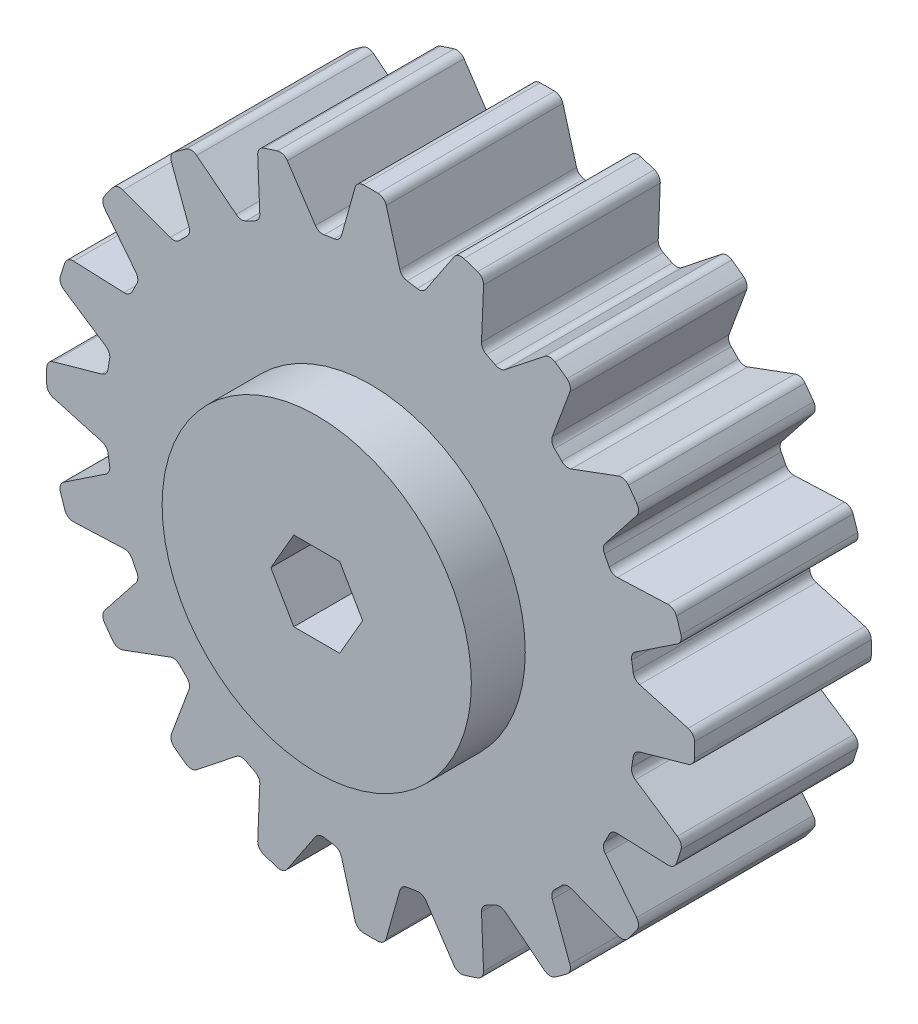
from build123d import *

# Parameters (mm, degrees)
SKETCH1_R                = 9
BODY_DEPTH               = 6
TOOTH_DEPTH              = 6
TOOTH_FILLET_R           = 0.3
TOOTH_START              = -6
TOOTH_PATTERN_DEPTH      = 6
SKETCH4_R                = 8
SKETCH4_R_2              = 5.25
RESSES2_DEPTH            = 1
BOSS_EXTRUDE1_DEPTH      = 1.83
BOSS_EXTRUDE1_DEPTH_BACK = 7.83
SKETCH9_R                = 5.25
CUT_EXTRUDE1_DEPTH       = 19.311624723
BOSS_EXTRUDE2_START      = 1
SKETCH11_R               = 8
SKETCH11_R_2             = 5.25
BOSS_EXTRUDE2_DEPTH      = 1


# Read off the part's stored shape, not the designer's step: Tooth Pattern
with BuildPart() as part:
    # Sketch1 → Body (new body)
    with BuildSketch(Plane.XY):
        Circle(SKETCH1_R)
    extrude(amount=-BODY_DEPTH)

    # Sketch2 → Tooth (add)
    with BuildSketch(Plane.XY):
        with BuildLine():
            Line((-0.755, 9.971458018), (-1.044579423, 8.939175232))
            ThreePointArc((-1.044579423, 8.939175232), (0, 9), (1.044579423, 8.939175232))
            Line((1.044579423, 8.939175232), (0.755, 9.971458018))
            Line((0.755, 9.971458018), (0.469279316, 10.989985301))
            ThreePointArc((0.469279316, 10.989985301), (0, 11), (-0.469279316, 10.989985301))
            Line((-0.469279316, 10.989985301), (-0.755, 9.971458018))
        make_face()
    extrude(amount=-TOOTH_DEPTH)

    # Tooth Fillet
    tooth_fillet_edges = [part.edges().sort_by_distance(p)[0] for p in [
        (1.044579423, 8.939175232, -3),
        (-1.044579423, 8.939175232, -3),
        (-0.469279316, 10.989985301, -3),
        (0.469279316, 10.989985301, -3),
    ]]
    fillet(tooth_fillet_edges, radius=TOOTH_FILLET_R)

    # Tooth Pattern outline → Tooth Pattern (add)
    with BuildSketch(Plane.XY.offset(TOOTH_START)):
        with BuildLine():
            ThreePointArc((-2.827914453, 10.414174029), (-2.975931492, 10.530102894), (-3.163875175, 10.535174127))
            ThreePointArc((-3.163875175, 10.535174127), (-3.399186938, 10.461621679), (-3.632791197, 10.382814075))
            ThreePointArc((-3.632791197, 10.382814075), (-3.781860036, 10.268240837), (-3.833467058, 10.087450182))
            Line((-3.833467058, 10.087450182), (-3.763889398, 8.37741104))
            ThreePointArc((-3.763889398, 8.37741104), (-3.806168906, 8.211241026), (-3.932556176, 8.095369165))
            ThreePointArc((-3.932556176, 8.095369165), (-2.781152949, 8.559508647), (-1.576833829, 8.860789754))
            ThreePointArc((-1.576833829, 8.860789754), (-1.74719105, 8.880243486), (-1.879068174, 8.98982658))
            Line((-1.879068174, 8.98982658), (-2.827914453, 10.414174029))
        make_face()
        with BuildLine():
            ThreePointArc((1.576833829, 8.860789754), (2.781152949, 8.559508647), (3.932556176, 8.095369165))
            ThreePointArc((3.932556176, 8.095369165), (3.806168906, 8.211241026), (3.763889398, 8.37741104))
            Line((3.763889398, 8.37741104), (3.833467058, 10.087450182))
            ThreePointArc((3.833467058, 10.087450182), (3.781860036, 10.268240837), (3.632791197, 10.382814075))
            ThreePointArc((3.632791197, 10.382814075), (3.399186938, 10.461621679), (3.163875175, 10.535174127))
            ThreePointArc((3.163875175, 10.535174127), (2.975931492, 10.530102894), (2.827914453, 10.414174029))
            Line((2.827914453, 10.414174029), (1.879068174, 8.98982658))
            ThreePointArc((1.879068174, 8.98982658), (1.74719105, 8.880243486), (1.576833829, 8.860789754))
        make_face()
        with BuildLine():
            ThreePointArc((4.237792706, 7.939843385), (5.290067271, 7.281152949), (6.241689825, 6.483926906))
            ThreePointArc((6.241689825, 6.483926906), (6.157294763, 6.633183409), (6.168433919, 6.80428557))
            Line((6.168433919, 6.80428557), (6.763037361, 8.40912876))
            ThreePointArc((6.763037361, 8.40912876), (6.769823551, 8.597018337), (6.663455739, 8.752048767))
            ThreePointArc((6.663455739, 8.752048767), (6.465637775, 8.899186938), (6.264571946, 9.041854806))
            ThreePointArc((6.264571946, 9.041854806), (6.084259784, 9.09510957), (5.907663226, 9.030594447))
            Line((5.907663226, 9.030594447), (4.565109221, 7.96916915))
            ThreePointArc((4.565109221, 7.96916915), (4.405823585, 7.905701707), (4.237792706, 7.939843385))
        make_face()
        with BuildLine():
            ThreePointArc((6.483926906, 6.241689825), (7.281152949, 5.290067271), (7.939843385, 4.237792706))
            ThreePointArc((7.939843385, 4.237792706), (7.905701707, 4.405823585), (7.96916915, 4.565109221))
            Line((7.96916915, 4.565109221), (9.030594447, 5.907663226))
            ThreePointArc((9.030594447, 5.907663226), (9.09510957, 6.084259784), (9.041854806, 6.264571946))
            ThreePointArc((9.041854806, 6.264571946), (8.899186938, 6.465637775), (8.752048767, 6.663455739))
            ThreePointArc((8.752048767, 6.663455739), (8.597018337, 6.769823551), (8.40912876, 6.763037361))
            Line((8.40912876, 6.763037361), (6.80428557, 6.168433919))
            ThreePointArc((6.80428557, 6.168433919), (6.633183409, 6.157294763), (6.483926906, 6.241689825))
        make_face()
        with BuildLine():
            ThreePointArc((8.095369165, 3.932556176), (8.559508647, 2.781152949), (8.860789755, 1.576833829))
            ThreePointArc((8.860789755, 1.576833829), (8.880243486, 1.74719105), (8.98982658, 1.879068174))
            Line((8.98982658, 1.879068174), (10.414174029, 2.827914453))
            ThreePointArc((10.414174029, 2.827914453), (10.530102894, 2.975931492), (10.535174127, 3.163875175))
            ThreePointArc((10.535174127, 3.163875175), (10.461621679, 3.399186938), (10.382814075, 3.632791197))
            ThreePointArc((10.382814075, 3.632791197), (10.268240837, 3.781860036), (10.087450182, 3.833467058))
            Line((10.087450182, 3.833467058), (8.37741104, 3.763889398))
            ThreePointArc((8.37741104, 3.763889398), (8.211241026, 3.806168906), (8.095369165, 3.932556176))
        make_face()
        with BuildLine():
            ThreePointArc((8.914380286, 1.238476529), (9, 0), (8.914380286, -1.238476529))
            ThreePointArc((8.914380286, -1.238476529), (8.985525161, -1.082468718), (9.130497149, -0.990909159))
            Line((9.130497149, -0.990909159), (10.778341697, -0.528650289))
            ThreePointArc((10.778341697, -0.528650289), (10.93433638, -0.42370171), (10.997237201, -0.246523742))
            ThreePointArc((10.997237201, -0.246523742), (11, 0), (10.997237201, 0.246523742))
            ThreePointArc((10.997237201, 0.246523742), (10.93433638, 0.42370171), (10.778341697, 0.528650289))
            Line((10.778341697, 0.528650289), (9.130497149, 0.990909159))
            ThreePointArc((9.130497149, 0.990909159), (8.985525161, 1.082468718), (8.914380286, 1.238476529))
        make_face()
        with BuildLine():
            ThreePointArc((8.860789755, -1.576833829), (8.559508647, -2.781152949), (8.095369165, -3.932556176))
            ThreePointArc((8.095369165, -3.932556176), (8.211241026, -3.806168906), (8.37741104, -3.763889398))
            Line((8.37741104, -3.763889398), (10.087450182, -3.833467058))
            ThreePointArc((10.087450182, -3.833467058), (10.268240837, -3.781860036), (10.382814075, -3.632791197))
            ThreePointArc((10.382814075, -3.632791197), (10.461621679, -3.399186938), (10.535174127, -3.163875175))
            ThreePointArc((10.535174127, -3.163875175), (10.530102894, -2.975931492), (10.414174029, -2.827914453))
            Line((10.414174029, -2.827914453), (8.98982658, -1.879068174))
            ThreePointArc((8.98982658, -1.879068174), (8.880243486, -1.74719105), (8.860789755, -1.576833829))
        make_face()
        with BuildLine():
            ThreePointArc((7.939843385, -4.237792706), (7.281152949, -5.290067271), (6.483926906, -6.241689825))
            ThreePointArc((6.483926906, -6.241689825), (6.633183409, -6.157294763), (6.80428557, -6.168433919))
            Line((6.80428557, -6.168433919), (8.40912876, -6.763037361))
            ThreePointArc((8.40912876, -6.763037361), (8.597018337, -6.769823551), (8.752048767, -6.663455739))
            ThreePointArc((8.752048767, -6.663455739), (8.899186938, -6.465637775), (9.041854806, -6.264571946))
            ThreePointArc((9.041854806, -6.264571946), (9.09510957, -6.084259784), (9.030594447, -5.907663226))
            Line((9.030594447, -5.907663226), (7.96916915, -4.565109221))
            ThreePointArc((7.96916915, -4.565109221), (7.905701707, -4.405823585), (7.939843385, -4.237792706))
        make_face()
        with BuildLine():
            ThreePointArc((6.241689825, -6.483926906), (5.290067271, -7.281152949), (4.237792706, -7.939843385))
            ThreePointArc((4.237792706, -7.939843385), (4.405823585, -7.905701707), (4.565109221, -7.96916915))
            Line((4.565109221, -7.96916915), (5.907663226, -9.030594447))
            ThreePointArc((5.907663226, -9.030594447), (6.084259784, -9.09510957), (6.264571946, -9.041854806))
            ThreePointArc((6.264571946, -9.041854806), (6.465637775, -8.899186938), (6.663455739, -8.752048767))
            ThreePointArc((6.663455739, -8.752048767), (6.769823551, -8.597018337), (6.763037361, -8.40912876))
            Line((6.763037361, -8.40912876), (6.168433919, -6.80428557))
            ThreePointArc((6.168433919, -6.80428557), (6.157294763, -6.633183409), (6.241689825, -6.483926906))
        make_face()
        with BuildLine():
            ThreePointArc((3.932556176, -8.095369165), (2.781152949, -8.559508647), (1.576833829, -8.860789755))
            ThreePointArc((1.576833829, -8.860789755), (1.74719105, -8.880243486), (1.879068174, -8.98982658))
            Line((1.879068174, -8.98982658), (2.827914453, -10.414174029))
            ThreePointArc((2.827914453, -10.414174029), (2.975931492, -10.530102894), (3.163875175, -10.535174127))
            ThreePointArc((3.163875175, -10.535174127), (3.399186938, -10.461621679), (3.632791197, -10.382814075))
            ThreePointArc((3.632791197, -10.382814075), (3.781860036, -10.268240837), (3.833467058, -10.087450182))
            Line((3.833467058, -10.087450182), (3.763889398, -8.37741104))
            ThreePointArc((3.763889398, -8.37741104), (3.806168906, -8.211241026), (3.932556176, -8.095369165))
        make_face()
        with BuildLine():
            ThreePointArc((1.238476529, -8.914380286), (0, -9), (-1.238476529, -8.914380286))
            ThreePointArc((-1.238476529, -8.914380286), (-1.082468718, -8.985525161), (-0.990909159, -9.130497149))
            Line((-0.990909159, -9.130497149), (-0.528650289, -10.778341697))
            ThreePointArc((-0.528650289, -10.778341697), (-0.42370171, -10.93433638), (-0.246523742, -10.997237201))
            ThreePointArc((-0.246523742, -10.997237201), (0, -11), (0.246523742, -10.997237201))
            ThreePointArc((0.246523742, -10.997237201), (0.42370171, -10.93433638), (0.528650289, -10.778341697))
            Line((0.528650289, -10.778341697), (0.990909159, -9.130497149))
            ThreePointArc((0.990909159, -9.130497149), (1.082468718, -8.985525161), (1.238476529, -8.914380286))
        make_face()
        with BuildLine():
            ThreePointArc((-1.576833829, -8.860789755), (-2.781152949, -8.559508647), (-3.932556176, -8.095369165))
            ThreePointArc((-3.932556176, -8.095369165), (-3.806168906, -8.211241026), (-3.763889398, -8.37741104))
            Line((-3.763889398, -8.37741104), (-3.833467058, -10.087450182))
            ThreePointArc((-3.833467058, -10.087450182), (-3.781860036, -10.268240837), (-3.632791197, -10.382814075))
            ThreePointArc((-3.632791197, -10.382814075), (-3.399186938, -10.461621679), (-3.163875175, -10.535174127))
            ThreePointArc((-3.163875175, -10.535174127), (-2.975931492, -10.530102894), (-2.827914453, -10.414174029))
            Line((-2.827914453, -10.414174029), (-1.879068174, -8.98982658))
            ThreePointArc((-1.879068174, -8.98982658), (-1.74719105, -8.880243486), (-1.576833829, -8.860789755))
        make_face()
        with BuildLine():
            ThreePointArc((-4.237792706, -7.939843385), (-5.290067271, -7.281152949), (-6.241689825, -6.483926906))
            ThreePointArc((-6.241689825, -6.483926906), (-6.157294763, -6.633183409), (-6.168433919, -6.80428557))
            Line((-6.168433919, -6.80428557), (-6.763037361, -8.40912876))
            ThreePointArc((-6.763037361, -8.40912876), (-6.769823551, -8.597018337), (-6.663455739, -8.752048767))
            ThreePointArc((-6.663455739, -8.752048767), (-6.465637775, -8.899186938), (-6.264571946, -9.041854806))
            ThreePointArc((-6.264571946, -9.041854806), (-6.084259784, -9.09510957), (-5.907663226, -9.030594447))
            Line((-5.907663226, -9.030594447), (-4.565109221, -7.96916915))
            ThreePointArc((-4.565109221, -7.96916915), (-4.405823585, -7.905701707), (-4.237792706, -7.939843385))
        make_face()
        with BuildLine():
            ThreePointArc((-6.483926906, -6.241689825), (-7.281152949, -5.290067271), (-7.939843385, -4.237792706))
            ThreePointArc((-7.939843385, -4.237792706), (-7.905701707, -4.405823585), (-7.96916915, -4.565109221))
            Line((-7.96916915, -4.565109221), (-9.030594447, -5.907663226))
            ThreePointArc((-9.030594447, -5.907663226), (-9.09510957, -6.084259784), (-9.041854806, -6.264571946))
            ThreePointArc((-9.041854806, -6.264571946), (-8.899186938, -6.465637775), (-8.752048767, -6.663455739))
            ThreePointArc((-8.752048767, -6.663455739), (-8.597018337, -6.769823551), (-8.40912876, -6.763037361))
            Line((-8.40912876, -6.763037361), (-6.80428557, -6.168433919))
            ThreePointArc((-6.80428557, -6.168433919), (-6.633183409, -6.157294763), (-6.483926906, -6.241689825))
        make_face()
        with BuildLine():
            ThreePointArc((-8.095369165, -3.932556176), (-8.559508647, -2.781152949), (-8.860789755, -1.576833829))
            ThreePointArc((-8.860789755, -1.576833829), (-8.880243486, -1.74719105), (-8.98982658, -1.879068174))
            Line((-8.98982658, -1.879068174), (-10.414174029, -2.827914453))
            ThreePointArc((-10.414174029, -2.827914453), (-10.530102894, -2.975931492), (-10.535174127, -3.163875175))
            ThreePointArc((-10.535174127, -3.163875175), (-10.461621679, -3.399186938), (-10.382814075, -3.632791197))
            ThreePointArc((-10.382814075, -3.632791197), (-10.268240837, -3.781860036), (-10.087450182, -3.833467058))
            Line((-10.087450182, -3.833467058), (-8.37741104, -3.763889398))
            ThreePointArc((-8.37741104, -3.763889398), (-8.211241026, -3.806168906), (-8.095369165, -3.932556176))
        make_face()
        with BuildLine():
            ThreePointArc((-8.914380286, -1.238476529), (-9, 0), (-8.914380286, 1.238476529))
            ThreePointArc((-8.914380286, 1.238476529), (-8.985525161, 1.082468718), (-9.130497149, 0.990909159))
            Line((-9.130497149, 0.990909159), (-10.778341697, 0.528650289))
            ThreePointArc((-10.778341697, 0.528650289), (-10.93433638, 0.42370171), (-10.997237201, 0.246523742))
            ThreePointArc((-10.997237201, 0.246523742), (-11, 0), (-10.997237201, -0.246523742))
            ThreePointArc((-10.997237201, -0.246523742), (-10.93433638, -0.42370171), (-10.778341697, -0.528650289))
            Line((-10.778341697, -0.528650289), (-9.130497149, -0.990909159))
            ThreePointArc((-9.130497149, -0.990909159), (-8.985525161, -1.082468718), (-8.914380286, -1.238476529))
        make_face()
        with BuildLine():
            ThreePointArc((-8.860789755, 1.576833829), (-8.559508647, 2.781152949), (-8.095369165, 3.932556176))
            ThreePointArc((-8.095369165, 3.932556176), (-8.211241026, 3.806168906), (-8.37741104, 3.763889398))
            Line((-8.37741104, 3.763889398), (-10.087450182, 3.833467058))
            ThreePointArc((-10.087450182, 3.833467058), (-10.268240837, 3.781860036), (-10.382814075, 3.632791197))
            ThreePointArc((-10.382814075, 3.632791197), (-10.461621679, 3.399186938), (-10.535174127, 3.163875175))
            ThreePointArc((-10.535174127, 3.163875175), (-10.530102894, 2.975931492), (-10.414174029, 2.827914453))
            Line((-10.414174029, 2.827914453), (-8.98982658, 1.879068174))
            ThreePointArc((-8.98982658, 1.879068174), (-8.880243486, 1.74719105), (-8.860789755, 1.576833829))
        make_face()
        with BuildLine():
            ThreePointArc((-7.939843385, 4.237792706), (-7.281152949, 5.290067271), (-6.483926906, 6.241689825))
            ThreePointArc((-6.483926906, 6.241689825), (-6.633183409, 6.157294763), (-6.80428557, 6.168433919))
            Line((-6.80428557, 6.168433919), (-8.40912876, 6.763037361))
            ThreePointArc((-8.40912876, 6.763037361), (-8.597018337, 6.769823551), (-8.752048767, 6.663455739))
            ThreePointArc((-8.752048767, 6.663455739), (-8.899186938, 6.465637775), (-9.041854806, 6.264571946))
            ThreePointArc((-9.041854806, 6.264571946), (-9.09510957, 6.084259784), (-9.030594447, 5.907663226))
            Line((-9.030594447, 5.907663226), (-7.96916915, 4.565109221))
            ThreePointArc((-7.96916915, 4.565109221), (-7.905701707, 4.405823585), (-7.939843385, 4.237792706))
        make_face()
        with BuildLine():
            ThreePointArc((-6.241689825, 6.483926906), (-5.290067271, 7.281152949), (-4.237792706, 7.939843385))
            ThreePointArc((-4.237792706, 7.939843385), (-4.405823585, 7.905701707), (-4.565109221, 7.96916915))
            Line((-4.565109221, 7.96916915), (-5.907663226, 9.030594447))
            ThreePointArc((-5.907663226, 9.030594447), (-6.084259784, 9.09510957), (-6.264571946, 9.041854806))
            ThreePointArc((-6.264571946, 9.041854806), (-6.465637775, 8.899186938), (-6.663455739, 8.752048767))
            ThreePointArc((-6.663455739, 8.752048767), (-6.769823551, 8.597018337), (-6.763037361, 8.40912876))
            Line((-6.763037361, 8.40912876), (-6.168433919, 6.80428557))
            ThreePointArc((-6.168433919, 6.80428557), (-6.157294763, 6.633183409), (-6.241689825, 6.483926906))
        make_face()
    extrude(amount=TOOTH_PATTERN_DEPTH)

    # Sketch4 → Resses2 (cut)
    with BuildSketch(Plane(origin=(0, 0, -6), x_dir=(-1, 0, 0), z_dir=(0, 0, -1))):
        Circle(SKETCH4_R)
        Circle(SKETCH4_R_2, mode=Mode.SUBTRACT)
    extrude(amount=-RESSES2_DEPTH, mode=Mode.SUBTRACT)

    # Sketch9 → Boss-Extrude1 (add, two sides: drawn at the far end of the back side and taken through both)
    with BuildSketch(Plane(origin=(0, 0, -6), x_dir=(-1, 0, 0), z_dir=(0, 0, -1)).offset(-BOSS_EXTRUDE1_DEPTH_BACK)):
        Circle(SKETCH9_R)
    extrude(amount=BOSS_EXTRUDE1_DEPTH + BOSS_EXTRUDE1_DEPTH_BACK)

    # Sketch10 → Cut-Extrude1 (cut, through all)
    with BuildSketch(Plane(origin=(0, 0, -7.83), x_dir=(-1, 0, 0), z_dir=(0, 0, -1))):
        Polygon((0.779422863, 1.35), (-0.779422863, 1.35), (-1.558845727, 0), (-0.779422863, -1.35), (0.779422863, -1.35), (1.558845727, 0), align=None)
    extrude(amount=-CUT_EXTRUDE1_DEPTH, mode=Mode.SUBTRACT)

    # Sketch11 → Boss-Extrude2 (add)
    with BuildSketch(Plane(origin=(0, 0, -5), x_dir=(-1, 0, 0), z_dir=(0, 0, -1)).offset(BOSS_EXTRUDE2_START)):
        Circle(SKETCH11_R)
        Circle(SKETCH11_R_2, mode=Mode.SUBTRACT)
    extrude(amount=-BOSS_EXTRUDE2_DEPTH)


solid = part.part
